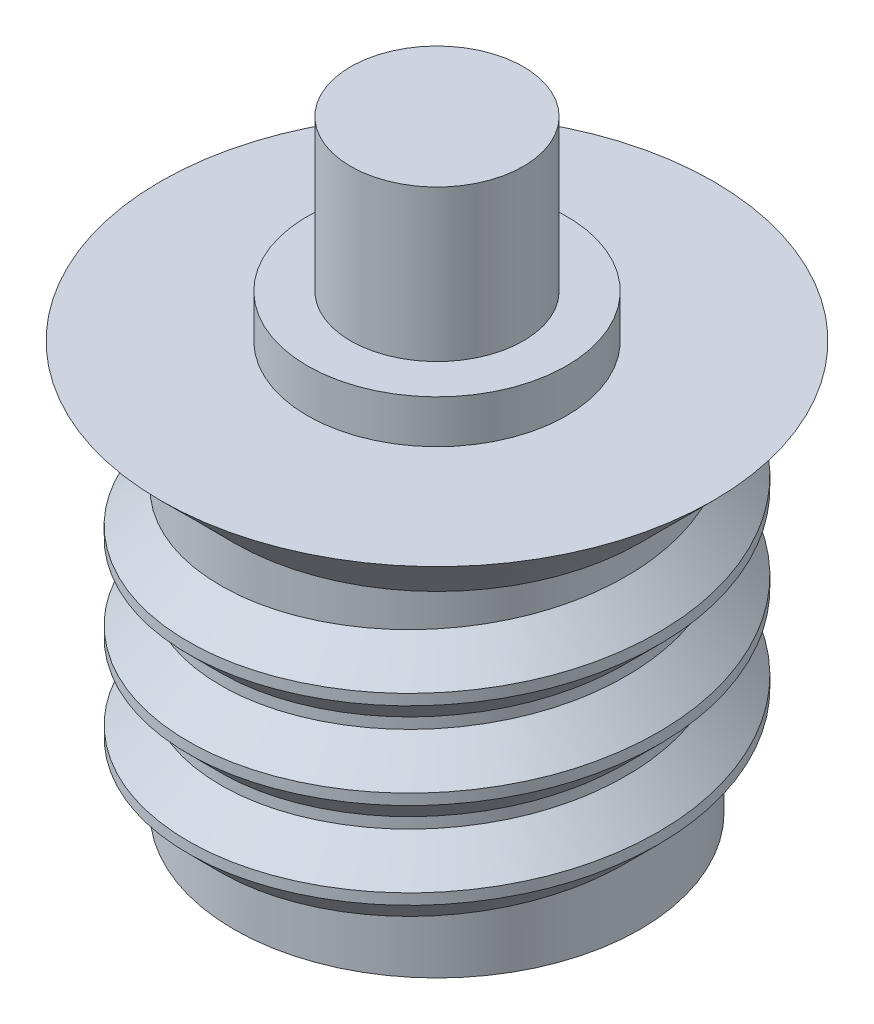
from build123d import *
from build123d.topology import SkipClean

# Parameters (mm, degrees)
SKETCH_1_R      = 9.4
EXTRUDE_1_DEPTH = 15.5
SKETCH_3_R      = 6
EXTRUDE_2_DEPTH = 2
SKETCH_4_R      = 4
EXTRUDE_3_DEPTH = 7
SWEEP_1_PITCH   = 4


with BuildPart() as part:
    # 草图1 → 凸台-拉伸1 (new body)
    with BuildSketch(Plane(origin=(0, 0, 0), x_dir=(1, 0, 0), z_dir=(0, 1, 0))):
        with Locations(Location((0, 0, 0), (0, 0, 270))):
            Circle(SKETCH_1_R)
    extrude(amount=EXTRUDE_1_DEPTH)

    # 草图2 → 旋转1 (revolve)
    with BuildSketch(Plane.XY, mode=Mode.PRIVATE) as revolve_1_sk:
        Polygon((0, 18.9), (12.8, 18.9), (9.4, 15.5), (0, 15.5), align=None)
    revolve(revolve_1_sk.sketch.rotate(Axis((0, 15.5, 0), (0, 1, 0)), 270), axis=Axis((0, 15.5, 0), (0, 1, 0)))

    # 草图3 → 凸台-拉伸2 (add)
    with BuildSketch(Plane(origin=(0, 18.9, 0), x_dir=(1, 0, 0), z_dir=(0, 1, 0))):
        with Locations(Location((0, 0, 0), (0, 0, 270))):
            Circle(SKETCH_3_R)
    extrude(amount=EXTRUDE_2_DEPTH)

    # 草图4 → 凸台-拉伸3 (add)
    with BuildSketch(Plane(origin=(0, 20.9, 0), x_dir=(1, 0, 0), z_dir=(0, 1, 0))):
        with Locations(Location((0, 0, 0), (0, 0, 270))):
            Circle(SKETCH_4_R)
    extrude(amount=EXTRUDE_3_DEPTH)

    # 扫描1: the profile of 草图8 profile screwed along a right-hand helix of 3 turns, 12 arcs to a turn; built about Z, then put on its axis
    with SkipClean():  # the faces are left unmerged after this step: merging them gives an invalid solid
        sweep_1_z = Axis((0, 0, 0), (0, 0, 1))
        sweep_1_corners = [(9.3997, 0, 1.7503), (9.3997, 0, -1.7503), (10.9, 0, -0.25), (10.9, 0, 0.25)]
        with BuildLine(mode=Mode.PRIVATE) as sweep_1_profile:
            Line(sweep_1_corners[0], sweep_1_corners[1])
            Line(sweep_1_corners[1], sweep_1_corners[2])
            Line(sweep_1_corners[2], sweep_1_corners[3])
            Line(sweep_1_corners[3], sweep_1_corners[0])
        sweep_1_cap = Face(sweep_1_profile.wire())
        sweep_1_turn_angles = [0, 15, 30, 45, 60, 75, 90, 105, 120, 135, 150, 165, 180, 195, 210, 225, 240, 255, 270, 285, 300, 315, 330, 345, 360]
        sweep_1_turn_weights = [1, 0.9659258262890683, 1, 0.9659258262890683, 1, 0.9659258262890683, 1, 0.9659258262890683, 1, 0.9659258262890683, 1, 0.9659258262890683, 1, 0.9659258262890683, 1, 0.9659258262890683, 1, 0.9659258262890683, 1, 0.9659258262890683, 1, 0.9659258262890683, 1, 0.9659258262890683, 1]
        sweep_1_turn_rails = [Edge.make_bspline([Vector(p[0], p[1], 0).rotate(sweep_1_z, sweep_1_turn_angles[k]) / sweep_1_turn_weights[k] + Vector(0, 0, p[2] + SWEEP_1_PITCH * sweep_1_turn_angles[k] / 360) for k in range(25)], [0, 0, 0, 1, 1, 2, 2, 3, 3, 4, 4, 5, 5, 6, 6, 7, 7, 8, 8, 9, 9, 10, 10, 11, 11, 12, 12, 12], 2, sweep_1_turn_weights) for p in sweep_1_corners]
        sweep_1_turn_sides = [Face.make_surface_from_curves(sweep_1_turn_rails[p[0]], sweep_1_turn_rails[p[1]]) for p in [(0, 1), (1, 2), (2, 3), (3, 0)]]
        sweep_1 = Plane(origin=(0, 1.75, 0), x_dir=(0, 0, -1), z_dir=(0, 1, 0)) * Solid(Shell([*[p.moved(Location((0, 0, SWEEP_1_PITCH * i))) for i in range(3) for p in sweep_1_turn_sides], sweep_1_cap, sweep_1_cap.rotate(sweep_1_z, 1080).moved(Location((0, 0, SWEEP_1_PITCH * 1080 / 360)))]))
        add(sweep_1)


solid = part.part
